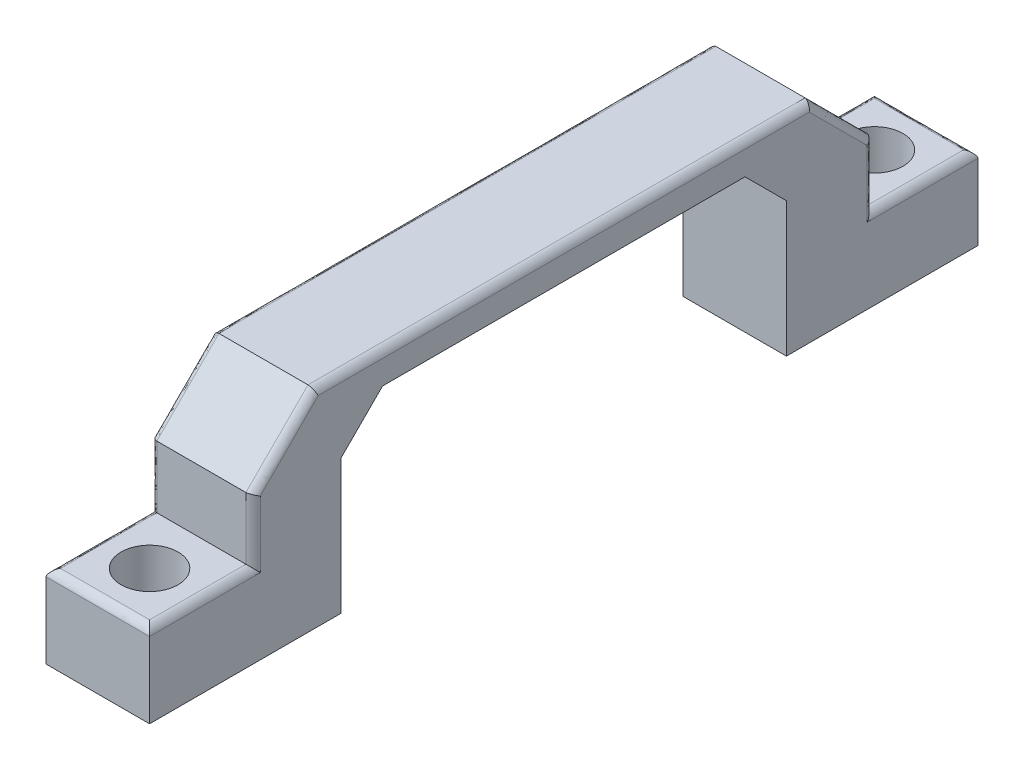
from build123d import *

# Parameters (mm, degrees)
SKETCH1_W           = 10
SKETCH1_H           = 80
BOSS_EXTRUDE1_DEPTH = 20
SKETCH2_R           = 2.75
CUT_EXTRUDE1_DEPTH  = 46
SKETCH4_W           = 10
SKETCH4_H           = 43
CUT_EXTRUDE2_DEPTH  = 17
CHAMFER1_SIZE       = 4
SKETCH5_W           = 10
SKETCH5_H           = 10
CUT_EXTRUDE3_DEPTH  = 12
CHAMFER2_SIZE       = 6
FILLET1_SIZE        = 0.7


with BuildPart() as part:
    # Sketch1 → Boss-Extrude1 (new body)
    with BuildSketch(Plane(origin=(0, 0, 0), x_dir=(1, 0, 0), z_dir=(0, 1, 0))):
        Rectangle(SKETCH1_W, SKETCH1_H)
    extrude(amount=BOSS_EXTRUDE1_DEPTH)

    # Sketch2 → Cut-Extrude1 (cut, through all)
    with BuildSketch(Plane(origin=(0, 20, 0), x_dir=(1, 0, 0), z_dir=(0, 1, 0))):
        with Locations(Location((0, 35, 0), (0, 0, 270))):
            Circle(SKETCH2_R)
        with Locations(Location((0, -35, 0), (0, 0, 90))):
            Circle(SKETCH2_R)
    extrude(amount=-CUT_EXTRUDE1_DEPTH, mode=Mode.SUBTRACT)

    # Sketch4 → Cut-Extrude2 (cut)
    with BuildSketch(Plane.XZ):
        Rectangle(SKETCH4_W, SKETCH4_H)
    extrude(amount=-CUT_EXTRUDE2_DEPTH, mode=Mode.SUBTRACT)

    # Chamfer1
    chamfer1_edges = [part.edges().sort_by_distance(p)[0] for p in [
        (0, 17, -21.5),
        (0, 17, 21.5),
    ]]
    chamfer(chamfer1_edges, length=CHAMFER1_SIZE)

    # Sketch5 → Cut-Extrude3 (cut)
    with BuildSketch(Plane(origin=(0, 20, 0), x_dir=(1, 0, 0), z_dir=(0, 1, 0))):
        with Locations((0, 35)):
            Rectangle(SKETCH5_W, SKETCH5_H)
    cut_extrude3 = extrude(amount=-CUT_EXTRUDE3_DEPTH, mode=Mode.SUBTRACT)

    # Mirror1: Cut-Extrude3 across plane
    add(cut_extrude3.mirror(Plane.XY), mode=Mode.SUBTRACT)

    # Chamfer2
    chamfer2_edges = [part.edges().sort_by_distance(p)[0] for p in [
        (0, 20, -30),
        (0, 20, 30),
    ]]
    chamfer(chamfer2_edges, length=CHAMFER2_SIZE)

    # Fillet1
    # a fillet whose section is not a circle: 0.7 mm, written as the material it takes off along each edge
    with BuildSketch(Plane(origin=(-5, 8, 41.75), x_dir=(0, -1, 0), z_dir=(0, 0, -1)), Plane(origin=(5, 8, -30), x_dir=(-1, 0, 0), z_dir=(0, 0, -1))) as fillet1_piece_1:
        with BuildLine():
            Bezier((FILLET1_SIZE, 0), (0, 0), (0, -FILLET1_SIZE), weights=[1, 0.333333333, 1])
            Line((0, -FILLET1_SIZE), (0, 0))
            Line((0, 0), (FILLET1_SIZE, 0))
        make_face()
    extrude(amount=11.75, mode=Mode.SUBTRACT)
    with BuildSketch(Plane(origin=(6.75, 8, 40), x_dir=(0, 0, -1), z_dir=(-1, 0, 0))) as fillet1_piece_2:
        with BuildLine():
            Bezier((FILLET1_SIZE, 0), (0, 0), (0, FILLET1_SIZE), weights=[1, 0.333333333, 1])
            Line((0, FILLET1_SIZE), (0, 0))
            Line((0, 0), (FILLET1_SIZE, 0))
        make_face()
    extrude(amount=13.5, mode=Mode.SUBTRACT)
    with BuildSketch(Plane(origin=(5, 8, 30), x_dir=(-1, 0, 0), z_dir=(0, 0, 1)), Plane(origin=(-5, 8, -41.75), x_dir=(0, -1, 0), z_dir=(0, 0, 1))) as fillet1_piece_3:
        with BuildLine():
            Bezier((FILLET1_SIZE, 0), (0, 0), (0, FILLET1_SIZE), weights=[1, 0.333333333, 1])
            Line((0, FILLET1_SIZE), (0, 0))
            Line((0, 0), (FILLET1_SIZE, 0))
        make_face()
    extrude(amount=11.75, mode=Mode.SUBTRACT)
    with BuildSketch(Plane(origin=(5, 15.75, 30), x_dir=(-1, 0, 0), z_dir=(0, -1, 0)), Plane(origin=(-5, 15.75, 30), x_dir=(0, 0, -1), z_dir=(0, -1, 0))) as fillet1_piece_4:
        with BuildLine():
            Bezier((FILLET1_SIZE, 0), (0, 0), (0, FILLET1_SIZE), weights=[1, 0.333333333, 1])
            Line((0, FILLET1_SIZE), (0, 0))
            Line((0, 0), (FILLET1_SIZE, 0))
        make_face()
    extrude(amount=7.75, mode=Mode.SUBTRACT)
    with BuildSketch(Plane(origin=(5, 12.762563133, 31.237436867), x_dir=(-1, 0, 0), z_dir=(0, 0.7071067811865476, -0.7071067811865476)), Plane(origin=(-5, 12.762563133, 31.237436867), x_dir=(0, -0.7071067811865476, -0.7071067811865476), z_dir=(0, 0.7071067811865476, -0.7071067811865476)), Plane(origin=(-5, 21.237436867, -22.762563133), x_dir=(0, -0.7071067811865476, 0.7071067811865476), z_dir=(0, -0.7071067811865476, -0.7071067811865476)), Plane(origin=(5, 21.237436867, -22.762563133), x_dir=(-1, 0, 0), z_dir=(0, -0.7071067811865476, -0.7071067811865476))) as fillet1_piece_5:
        with BuildLine():
            Bezier((FILLET1_SIZE, 0), (0, 0), (0, -FILLET1_SIZE), weights=[1, 0.333333333, 1])
            Line((0, -FILLET1_SIZE), (0, 0))
            Line((0, 0), (FILLET1_SIZE, 0))
        make_face()
    extrude(amount=11.985281374, mode=Mode.SUBTRACT)
    with BuildSketch(Plane(origin=(-5, 20, -25.75), x_dir=(0, -1, 0), z_dir=(0, 0, 1))) as fillet1_piece_6:
        with BuildLine():
            Bezier((FILLET1_SIZE, 0), (0, 0), (0, FILLET1_SIZE), weights=[1, 0.333333333, 1])
            Line((0, FILLET1_SIZE), (0, 0))
            Line((0, 0), (FILLET1_SIZE, 0))
        make_face()
    extrude(amount=51.5, mode=Mode.SUBTRACT)
    with BuildSketch(Plane(origin=(-5, 15.75, -30), x_dir=(0, 0, 1), z_dir=(0, -1, 0)), Plane(origin=(5, 15.75, -30), x_dir=(-1, 0, 0), z_dir=(0, -1, 0))) as fillet1_piece_7:
        with BuildLine():
            Bezier((FILLET1_SIZE, 0), (0, 0), (0, -FILLET1_SIZE), weights=[1, 0.333333333, 1])
            Line((0, -FILLET1_SIZE), (0, 0))
            Line((0, 0), (FILLET1_SIZE, 0))
        make_face()
    extrude(amount=7.75, mode=Mode.SUBTRACT)
    with BuildSketch(Plane(origin=(6.75, 8, -40), x_dir=(0, 0, 1), z_dir=(-1, 0, 0))) as fillet1_piece_8:
        with BuildLine():
            Bezier((FILLET1_SIZE, 0), (0, 0), (0, -FILLET1_SIZE), weights=[1, 0.333333333, 1])
            Line((0, -FILLET1_SIZE), (0, 0))
            Line((0, 0), (FILLET1_SIZE, 0))
        make_face()
    extrude(amount=13.5, mode=Mode.SUBTRACT)
    with BuildSketch(Plane(origin=(5, 20, 25.75), x_dir=(-1, 0, 0), z_dir=(0, 0, -1))) as fillet1_piece_9:
        with BuildLine():
            Bezier((FILLET1_SIZE, 0), (0, 0), (0, -FILLET1_SIZE), weights=[1, 0.333333333, 1])
            Line((0, -FILLET1_SIZE), (0, 0))
            Line((0, 0), (FILLET1_SIZE, 0))
        make_face()
    extrude(amount=51.5, mode=Mode.SUBTRACT)
    with BuildSketch(Plane(origin=(-5, 15.75, 30), x_dir=(0, 0, -1), z_dir=(0, -1, 0))) as fillet1_piece_10a_section:
        with BuildLine():
            Bezier((FILLET1_SIZE, 0), (0, 0), (0, FILLET1_SIZE), weights=[1, 0.333333333, 1])
            Line((0, FILLET1_SIZE), (0, 0))
            Line((0, 0), (FILLET1_SIZE, 0))
        make_face()
    fillet1_piece_10a = extrude(amount=9.5, mode=Mode.PRIVATE)
    fillet1_piece_10a = split(fillet1_piece_10a, bisect_by=Plane(origin=(-5, 8, 30), z_dir=(0, -1, 0)), keep=Keep.TOP, mode=Mode.PRIVATE)
    with BuildSketch(Plane(origin=(-5, 8, 41.75), x_dir=(0, -1, 0), z_dir=(0, 0, -1))) as fillet1_piece_10b_section:
        with BuildLine():
            Bezier((FILLET1_SIZE, 0), (0, 0), (0, -FILLET1_SIZE), weights=[1, 0.333333333, 1])
            Line((0, -FILLET1_SIZE), (0, 0))
            Line((0, 0), (FILLET1_SIZE, 0))
        make_face()
    fillet1_piece_10b = extrude(amount=13.5, mode=Mode.PRIVATE)
    fillet1_piece_10b = split(fillet1_piece_10b, bisect_by=Plane(origin=(-5, 8, 30), z_dir=(0, 0, -1)), keep=Keep.TOP, mode=Mode.PRIVATE)
    fillet1_piece_10 = fillet1_piece_10a & fillet1_piece_10b
    add(fillet1_piece_10, mode=Mode.SUBTRACT)
    with BuildSketch(Plane(origin=(5, 15.75, 30), x_dir=(-1, 0, 0), z_dir=(0, -1, 0))) as fillet1_piece_11a_section:
        with BuildLine():
            Bezier((FILLET1_SIZE, 0), (0, 0), (0, FILLET1_SIZE), weights=[1, 0.333333333, 1])
            Line((0, FILLET1_SIZE), (0, 0))
            Line((0, 0), (FILLET1_SIZE, 0))
        make_face()
    fillet1_piece_11a = extrude(amount=9.5, mode=Mode.PRIVATE)
    fillet1_piece_11a = split(fillet1_piece_11a, bisect_by=Plane(origin=(5, 8, 30), z_dir=(0, -1, 0)), keep=Keep.TOP, mode=Mode.PRIVATE)
    with BuildSketch(Plane(origin=(5, 8, 28.25), x_dir=(-1, 0, 0), z_dir=(0, 0, 1))) as fillet1_piece_11b_section:
        with BuildLine():
            Bezier((FILLET1_SIZE, 0), (0, 0), (0, FILLET1_SIZE), weights=[1, 0.333333333, 1])
            Line((0, FILLET1_SIZE), (0, 0))
            Line((0, 0), (FILLET1_SIZE, 0))
        make_face()
    fillet1_piece_11b = extrude(amount=13.5, mode=Mode.PRIVATE)
    fillet1_piece_11b = split(fillet1_piece_11b, bisect_by=Plane(origin=(5, 8, 30), z_dir=(0, 0, -1)), keep=Keep.TOP, mode=Mode.PRIVATE)
    fillet1_piece_11 = fillet1_piece_11a & fillet1_piece_11b
    add(fillet1_piece_11, mode=Mode.SUBTRACT)
    with BuildSketch(Plane(origin=(-5, 15.75, -30), x_dir=(0, 0, 1), z_dir=(0, -1, 0))) as fillet1_piece_12a_section:
        with BuildLine():
            Bezier((FILLET1_SIZE, 0), (0, 0), (0, -FILLET1_SIZE), weights=[1, 0.333333333, 1])
            Line((0, -FILLET1_SIZE), (0, 0))
            Line((0, 0), (FILLET1_SIZE, 0))
        make_face()
    fillet1_piece_12a = extrude(amount=9.5, mode=Mode.PRIVATE)
    fillet1_piece_12a = split(fillet1_piece_12a, bisect_by=Plane(origin=(-5, 8, -30), z_dir=(0, -1, 0)), keep=Keep.TOP, mode=Mode.PRIVATE)
    with BuildSketch(Plane(origin=(-5, 8, -41.75), x_dir=(0, -1, 0), z_dir=(0, 0, 1))) as fillet1_piece_12b_section:
        with BuildLine():
            Bezier((FILLET1_SIZE, 0), (0, 0), (0, FILLET1_SIZE), weights=[1, 0.333333333, 1])
            Line((0, FILLET1_SIZE), (0, 0))
            Line((0, 0), (FILLET1_SIZE, 0))
        make_face()
    fillet1_piece_12b = extrude(amount=13.5, mode=Mode.PRIVATE)
    fillet1_piece_12b = split(fillet1_piece_12b, bisect_by=Plane(origin=(-5, 8, -30), z_dir=(0, 0, 1)), keep=Keep.TOP, mode=Mode.PRIVATE)
    fillet1_piece_12 = fillet1_piece_12a & fillet1_piece_12b
    add(fillet1_piece_12, mode=Mode.SUBTRACT)
    with BuildSketch(Plane(origin=(5, 15.75, -30), x_dir=(-1, 0, 0), z_dir=(0, -1, 0))) as fillet1_piece_13a_section:
        with BuildLine():
            Bezier((FILLET1_SIZE, 0), (0, 0), (0, -FILLET1_SIZE), weights=[1, 0.333333333, 1])
            Line((0, -FILLET1_SIZE), (0, 0))
            Line((0, 0), (FILLET1_SIZE, 0))
        make_face()
    fillet1_piece_13a = extrude(amount=9.5, mode=Mode.PRIVATE)
    fillet1_piece_13a = split(fillet1_piece_13a, bisect_by=Plane(origin=(5, 8, -30), z_dir=(0, -1, 0)), keep=Keep.TOP, mode=Mode.PRIVATE)
    with BuildSketch(Plane(origin=(5, 8, -28.25), x_dir=(-1, 0, 0), z_dir=(0, 0, -1))) as fillet1_piece_13b_section:
        with BuildLine():
            Bezier((FILLET1_SIZE, 0), (0, 0), (0, -FILLET1_SIZE), weights=[1, 0.333333333, 1])
            Line((0, -FILLET1_SIZE), (0, 0))
            Line((0, 0), (FILLET1_SIZE, 0))
        make_face()
    fillet1_piece_13b = extrude(amount=13.5, mode=Mode.PRIVATE)
    fillet1_piece_13b = split(fillet1_piece_13b, bisect_by=Plane(origin=(5, 8, -30), z_dir=(0, 0, 1)), keep=Keep.TOP, mode=Mode.PRIVATE)
    fillet1_piece_13 = fillet1_piece_13a & fillet1_piece_13b
    add(fillet1_piece_13, mode=Mode.SUBTRACT)


solid = part.part
